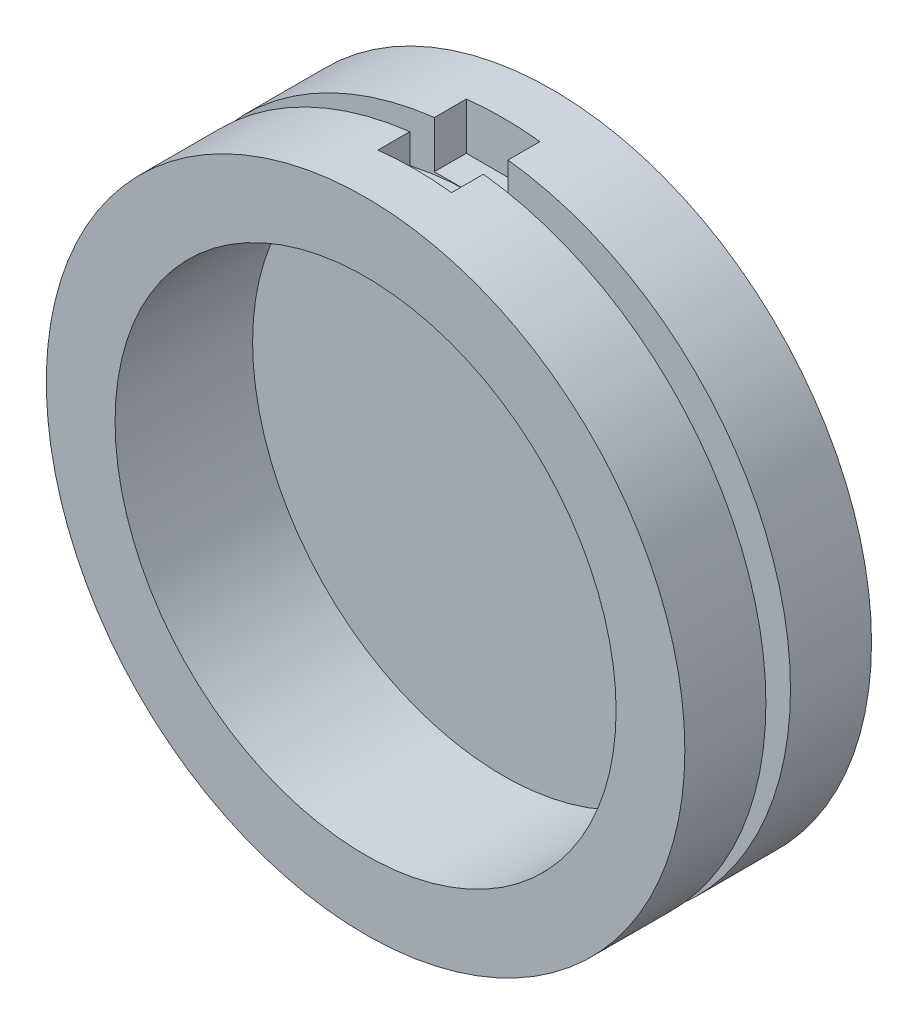
from build123d import *

# Parameters (mm, degrees)
SKETCH7_W          = 7.5
SKETCH7_H          = 9
CUT_EXTRUDE1_DEPTH = 5


with BuildPart() as part:
    # Sketch2 → Revolve1 (revolve)
    with BuildSketch(Plane(origin=(0, 0, 0), x_dir=(0, 0, -1), z_dir=(1, 0, 0))):
        Polygon((0, 0), (0, 32.5), (-8.25, 32.5), (-8.25, 27.5), (-10.75, 27.5), (-10.75, 32.5), (-19, 32.5), (-19, 25.5), (-5, 25.5), (-5, 0), align=None)
    revolve(axis=Axis((0, 0, 5), (0, 0, -1)))

    # Sketch7 → Cut-Extrude1 (cut)
    with BuildSketch(Plane(origin=(0, 32.5, 0), x_dir=(1, 0, 0), z_dir=(0, 1, 0))):
        with Locations((0, -9.5)):
            Rectangle(SKETCH7_W, SKETCH7_H)
    cut_extrude1 = extrude(amount=-CUT_EXTRUDE1_DEPTH, mode=Mode.SUBTRACT)

    # Mirror1: Cut-Extrude1 across plane
    add(cut_extrude1.mirror(Plane.ZX), mode=Mode.SUBTRACT)


solid = part.part
